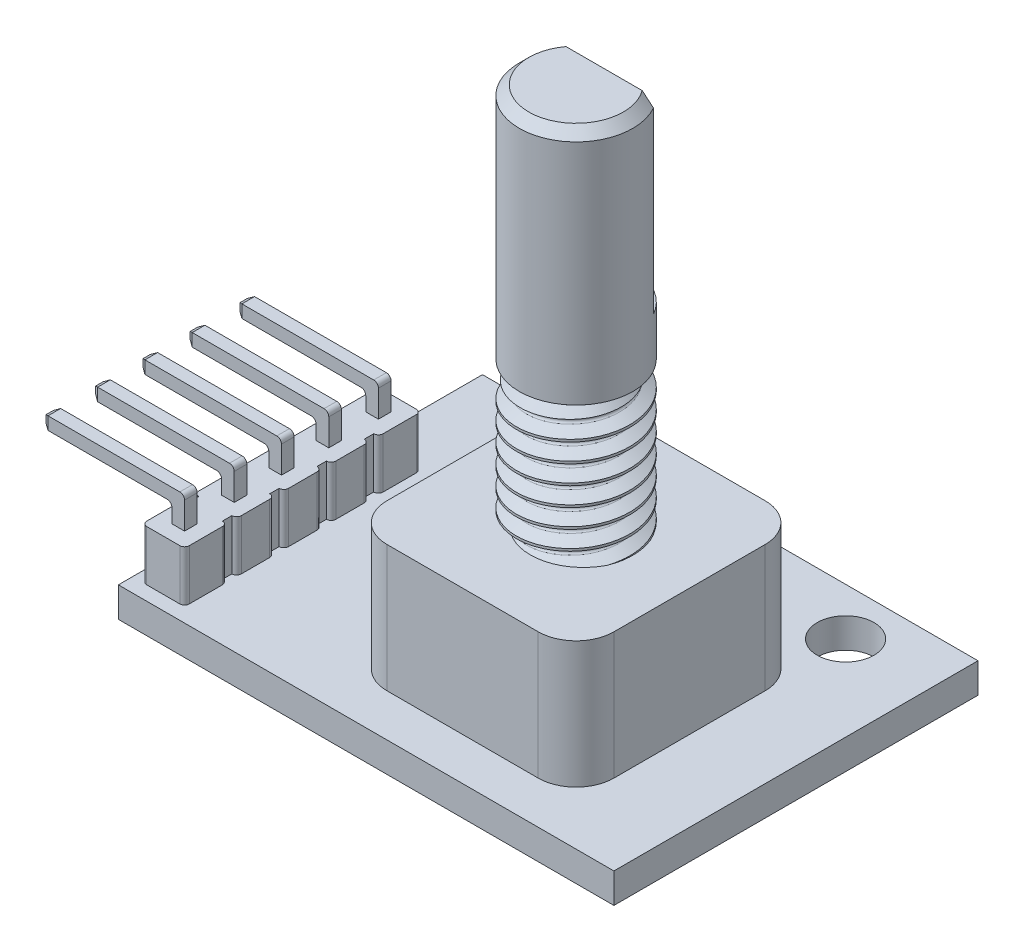
from build123d import *
from OCP.BRepFilletAPI import BRepFilletAPI_MakeChamfer

# Parameters (mm, degrees)
ESBO_O2_W                 = 26.2
ESBO_O2_H                 = 19.25
ESBO_O2_R                 = 1.5
ESBO_O2_W_2               = 12
ESBO_O2_H_2               = 12
RESSALTO_EXTRUS_O1_DEPTH  = 1.58
ESBO_O2_2_W               = 12
ESBO_O2_2_H               = 12
RESSALTO_EXTRUS_O2_DEPTH  = 8.28
RESSALTO_EXTRUS_O3_DEPTH  = 2.67
FILETE1_R                 = 0.25
ESBO_O4_W                 = 0.67
ESBO_O4_H                 = 0.67
RESSALTO_EXTRUS_O4_DEPTH  = 1.67
ESBO_O5_W                 = 0.67
ESBO_O5_H                 = 0.67
RESSALTO_EXTRUS_O5_DEPTH  = 6.8
FILETE2_R                 = 0.25
CHANFRO1_SIZE             = 0.25
CHANFRO1_SIZE2            = 0.144338
ESBO_O6_R                 = 3
ESBO_O6_R_2               = 1.5
RESSALTO_EXTRUS_O6_DEPTH  = 7
RESSALTO_EXTRUS_O7_START  = 7
ESBO_O6_3_R               = 1.5
RESSALTO_EXTRUS_O7_DEPTH  = 0.5
RESSALTO_EXTRUS_O8_START  = 7.5
ESBO_O6_4_R               = 3
ESBO_O6_4_R_2             = 1.5
RESSALTO_EXTRUS_O8_DEPTH  = 2.6
RESSALTO_EXTRUS_O9_DEPTH  = 9.95
CHANFRO2_SIZE             = 0.5
FILETE3_R                 = 2
CHANFRO3_SIZE             = 0.7
VARREDURA_DE_CORTE1_PITCH = 1
VARREDURA_DE_CORTE1_TO    = 7


with BuildPart() as part:
    # Esboço2 → Ressalto-extrusão1 (new body)
    with BuildSketch(Plane(origin=(0, 0, 0), x_dir=(1, 0, 0), z_dir=(0, 1, 0))):
        with Locations((-2.85, 1.375)):
            Rectangle(ESBO_O2_W, ESBO_O2_H)
        with Locations(Location((-11.15, 8.5, 0), (0, 0, 90))):
            Circle(ESBO_O2_R, mode=Mode.SUBTRACT)
        with Locations(Location((5.75, 8.5, 0), (0, 0, 90))):
            Circle(ESBO_O2_R, mode=Mode.SUBTRACT)
        Rectangle(ESBO_O2_W_2, ESBO_O2_H_2, mode=Mode.SUBTRACT)
    extrude(amount=RESSALTO_EXTRUS_O1_DEPTH)

    # Esboço2<2> → Ressalto-extrusão2 (add)
    with BuildSketch(Plane(origin=(0, 0, 0), x_dir=(1, 0, 0), z_dir=(0, 1, 0))):
        Rectangle(ESBO_O2_2_W, ESBO_O2_2_H)
    extrude(amount=RESSALTO_EXTRUS_O2_DEPTH)

    # Esboço3 → Ressalto-extrusão3 (add)
    with BuildSketch(Plane(origin=(0, 1.58, 0), x_dir=(1, 0, 0), z_dir=(0, 1, 0))):
        Polygon((-15.45, 5), (-13.2, 5), (-13.2, 2.75), (-13.45, 2.75), (-13.45, 2.25), (-13.2, 2.25), (-13.2, 0.25), (-13.45, 0.25), (-13.45, -0.25), (-13.2, -0.25), (-13.2, -2.25), (-13.45, -2.25), (-13.45, -2.75), (-13.2, -2.75), (-13.2, -4.75), (-13.45, -4.75), (-13.45, -5.25), (-13.2, -5.25), (-13.2, -7.5), (-15.45, -7.5), (-15.45, -5.25), (-15.2, -5.25), (-15.2, -4.75), (-15.45, -4.75), (-15.45, -2.75), (-15.2, -2.75), (-15.2, -2.25), (-15.45, -2.25), (-15.45, -0.25), (-15.2, -0.25), (-15.2, 0.25), (-15.45, 0.25), (-15.45, 2.25), (-15.2, 2.25), (-15.2, 2.75), (-15.45, 2.75), align=None)
    extrude(amount=RESSALTO_EXTRUS_O3_DEPTH)

    # Filete1
    filete1_edges = [part.edges().sort_by_distance(p)[0] for p in [
        (-13.2, 2.915, -5),
        (-13.2, 2.915, -2.75),
        (-13.2, 2.915, -2.25),
        (-13.2, 2.915, -0.25),
        (-13.2, 2.915, 0.25),
        (-13.2, 2.915, 2.25),
        (-13.2, 2.915, 2.75),
        (-13.2, 2.915, 5.25),
        (-13.2, 2.915, 4.75),
        (-15.45, 2.915, -5),
        (-15.45, 2.915, -2.75),
        (-15.45, 2.915, -2.25),
        (-15.45, 2.915, -0.25),
        (-15.45, 2.915, 0.25),
        (-15.45, 2.915, 2.25),
        (-15.45, 2.915, 2.75),
        (-15.45, 2.915, 4.75),
        (-15.45, 2.915, 5.25),
        (-13.2, 2.915, 7.5),
        (-15.45, 2.915, 7.5),
    ]]
    fillet(filete1_edges, radius=FILETE1_R - 0.0001)  # a hair under: the kernel refuses the full size

    # Esboço4 → Ressalto-extrusão4 (add)
    with BuildSketch(Plane(origin=(0, 4.25, 0), x_dir=(1, 0, 0), z_dir=(0, 1, 0))):
        with Locations((-14.325, 3.875)):
            Rectangle(ESBO_O4_W, ESBO_O4_H)
        with Locations((-14.325, 1.25)):
            Rectangle(ESBO_O4_W, ESBO_O4_H)
        with Locations((-14.325, -1.25)):
            Rectangle(ESBO_O4_W, ESBO_O4_H)
        with Locations((-14.325, -3.75)):
            Rectangle(ESBO_O4_W, ESBO_O4_H)
        with Locations((-14.325, -6.375)):
            Rectangle(ESBO_O4_W, ESBO_O4_H)
    extrude(amount=RESSALTO_EXTRUS_O4_DEPTH)

    # Esboço5 → Ressalto-extrusão5 (add)
    with BuildSketch(Plane.ZY.offset(14.66)):
        with Locations((6.375, 5.585)):
            Rectangle(ESBO_O5_W, ESBO_O5_H)
        with Locations((3.75, 5.585)):
            Rectangle(ESBO_O5_W, ESBO_O5_H)
        with Locations((1.25, 5.585)):
            Rectangle(ESBO_O5_W, ESBO_O5_H)
        with Locations((-1.25, 5.585)):
            Rectangle(ESBO_O5_W, ESBO_O5_H)
        with Locations((-3.875, 5.585)):
            Rectangle(ESBO_O5_W, ESBO_O5_H)
    extrude(amount=RESSALTO_EXTRUS_O5_DEPTH)

    # Filete2
    filete2_edges = [part.edges().sort_by_distance(p)[0] for p in [
        (-13.99, 5.92, -3.875),
        (-13.99, 5.92, -1.25),
        (-13.99, 5.92, 1.25),
        (-13.99, 5.92, 3.75),
        (-13.99, 5.92, 6.375),
        (-14.66, 5.25, -3.875),
        (-14.66, 5.25, 6.375),
        (-14.66, 5.25, -1.25),
        (-14.66, 5.25, 3.75),
        (-14.66, 5.25, 1.25),
    ]]
    fillet(filete2_edges, radius=FILETE2_R)

    # Chanfro1: one chamfer whose edges measure the first distance from different faces: ONE call of the kernel's chamfer builder (chamfer() names one face for all edges)
    chanfro1_edges_1 = [part.edges().sort_by_distance(p)[0] for p in [
        (-21.46, 5.25, -3.875),
    ]]
    chanfro1_side_1 = [part.faces().sort_by_distance(p)[0] for p in [
        (-18.185, 5.25, -3.875),
    ]]
    chanfro1_edges_2 = [part.edges().sort_by_distance(p)[0] for p in [
        (-21.46, 5.585, -3.54),
    ]]
    chanfro1_side_2 = [part.faces().sort_by_distance(p)[0] for p in [
        (-17.325167, 5.484833, -3.54),
    ]]
    chanfro1_edges_3 = [part.edges().sort_by_distance(p)[0] for p in [
        (-21.46, 5.92, -3.875),
    ]]
    chanfro1_side_3 = [part.faces().sort_by_distance(p)[0] for p in [
        (-17.85, 5.92, -3.875),
    ]]
    chanfro1_edges_4 = [part.edges().sort_by_distance(p)[0] for p in [
        (-21.46, 5.585, -4.21),
    ]]
    chanfro1_side_4 = [part.faces().sort_by_distance(p)[0] for p in [
        (-17.325167, 5.484833, -4.21),
    ]]
    chanfro1_edges_5 = [part.edges().sort_by_distance(p)[0] for p in [
        (-21.46, 5.92, 6.375),
    ]]
    chanfro1_side_5 = [part.faces().sort_by_distance(p)[0] for p in [
        (-17.85, 5.92, 6.375),
    ]]
    chanfro1_edges_6 = [part.edges().sort_by_distance(p)[0] for p in [
        (-21.46, 5.585, 6.04),
    ]]
    chanfro1_side_6 = [part.faces().sort_by_distance(p)[0] for p in [
        (-17.325167, 5.484833, 6.04),
    ]]
    chanfro1_edges_7 = [part.edges().sort_by_distance(p)[0] for p in [
        (-21.46, 5.25, 6.375),
    ]]
    chanfro1_side_7 = [part.faces().sort_by_distance(p)[0] for p in [
        (-18.185, 5.25, 6.375),
    ]]
    chanfro1_edges_8 = [part.edges().sort_by_distance(p)[0] for p in [
        (-21.46, 5.585, 6.71),
    ]]
    chanfro1_side_8 = [part.faces().sort_by_distance(p)[0] for p in [
        (-17.325167, 5.484833, 6.71),
    ]]
    chanfro1_edges_9 = [part.edges().sort_by_distance(p)[0] for p in [
        (-21.46, 5.25, -1.25),
    ]]
    chanfro1_side_9 = [part.faces().sort_by_distance(p)[0] for p in [
        (-18.185, 5.25, -1.25),
    ]]
    chanfro1_edges_10 = [part.edges().sort_by_distance(p)[0] for p in [
        (-21.46, 5.585, -0.915),
    ]]
    chanfro1_side_10 = [part.faces().sort_by_distance(p)[0] for p in [
        (-17.325167, 5.484833, -0.915),
    ]]
    chanfro1_edges_11 = [part.edges().sort_by_distance(p)[0] for p in [
        (-21.46, 5.92, -1.25),
    ]]
    chanfro1_side_11 = [part.faces().sort_by_distance(p)[0] for p in [
        (-17.85, 5.92, -1.25),
    ]]
    chanfro1_edges_12 = [part.edges().sort_by_distance(p)[0] for p in [
        (-21.46, 5.585, -1.585),
    ]]
    chanfro1_side_12 = [part.faces().sort_by_distance(p)[0] for p in [
        (-17.325167, 5.484833, -1.585),
    ]]
    chanfro1_edges_13 = [part.edges().sort_by_distance(p)[0] for p in [
        (-21.46, 5.92, 3.75),
    ]]
    chanfro1_side_13 = [part.faces().sort_by_distance(p)[0] for p in [
        (-17.85, 5.92, 3.75),
    ]]
    chanfro1_edges_14 = [part.edges().sort_by_distance(p)[0] for p in [
        (-21.46, 5.585, 3.415),
    ]]
    chanfro1_side_14 = [part.faces().sort_by_distance(p)[0] for p in [
        (-17.325167, 5.484833, 3.415),
    ]]
    chanfro1_edges_15 = [part.edges().sort_by_distance(p)[0] for p in [
        (-21.46, 5.25, 3.75),
    ]]
    chanfro1_side_15 = [part.faces().sort_by_distance(p)[0] for p in [
        (-18.185, 5.25, 3.75),
    ]]
    chanfro1_edges_16 = [part.edges().sort_by_distance(p)[0] for p in [
        (-21.46, 5.585, 4.085),
    ]]
    chanfro1_side_16 = [part.faces().sort_by_distance(p)[0] for p in [
        (-17.325167, 5.484833, 4.085),
    ]]
    chanfro1_edges_17 = [part.edges().sort_by_distance(p)[0] for p in [
        (-21.46, 5.25, 1.25),
    ]]
    chanfro1_side_17 = [part.faces().sort_by_distance(p)[0] for p in [
        (-18.185, 5.25, 1.25),
    ]]
    chanfro1_edges_18 = [part.edges().sort_by_distance(p)[0] for p in [
        (-21.46, 5.585, 1.585),
    ]]
    chanfro1_side_18 = [part.faces().sort_by_distance(p)[0] for p in [
        (-17.325167, 5.484833, 1.585),
    ]]
    chanfro1_edges_19 = [part.edges().sort_by_distance(p)[0] for p in [
        (-21.46, 5.92, 1.25),
    ]]
    chanfro1_side_19 = [part.faces().sort_by_distance(p)[0] for p in [
        (-17.85, 5.92, 1.25),
    ]]
    chanfro1_edges_20 = [part.edges().sort_by_distance(p)[0] for p in [
        (-21.46, 5.585, 0.915),
    ]]
    chanfro1_side_20 = [part.faces().sort_by_distance(p)[0] for p in [
        (-17.325167, 5.484833, 0.915),
    ]]
    chanfro1 = BRepFilletAPI_MakeChamfer(part.part.solid().wrapped)
    for e in chanfro1_edges_1:
        chanfro1.Add(CHANFRO1_SIZE, CHANFRO1_SIZE2, e.wrapped, chanfro1_side_1[0].wrapped)  # the first distance lies on this face
    for e in chanfro1_edges_2:
        chanfro1.Add(CHANFRO1_SIZE, CHANFRO1_SIZE2, e.wrapped, chanfro1_side_2[0].wrapped)  # the first distance lies on this face
    for e in chanfro1_edges_3:
        chanfro1.Add(CHANFRO1_SIZE, CHANFRO1_SIZE2, e.wrapped, chanfro1_side_3[0].wrapped)  # the first distance lies on this face
    for e in chanfro1_edges_4:
        chanfro1.Add(CHANFRO1_SIZE, CHANFRO1_SIZE2, e.wrapped, chanfro1_side_4[0].wrapped)  # the first distance lies on this face
    for e in chanfro1_edges_5:
        chanfro1.Add(CHANFRO1_SIZE, CHANFRO1_SIZE2, e.wrapped, chanfro1_side_5[0].wrapped)  # the first distance lies on this face
    for e in chanfro1_edges_6:
        chanfro1.Add(CHANFRO1_SIZE, CHANFRO1_SIZE2, e.wrapped, chanfro1_side_6[0].wrapped)  # the first distance lies on this face
    for e in chanfro1_edges_7:
        chanfro1.Add(CHANFRO1_SIZE, CHANFRO1_SIZE2, e.wrapped, chanfro1_side_7[0].wrapped)  # the first distance lies on this face
    for e in chanfro1_edges_8:
        chanfro1.Add(CHANFRO1_SIZE, CHANFRO1_SIZE2, e.wrapped, chanfro1_side_8[0].wrapped)  # the first distance lies on this face
    for e in chanfro1_edges_9:
        chanfro1.Add(CHANFRO1_SIZE, CHANFRO1_SIZE2, e.wrapped, chanfro1_side_9[0].wrapped)  # the first distance lies on this face
    for e in chanfro1_edges_10:
        chanfro1.Add(CHANFRO1_SIZE, CHANFRO1_SIZE2, e.wrapped, chanfro1_side_10[0].wrapped)  # the first distance lies on this face
    for e in chanfro1_edges_11:
        chanfro1.Add(CHANFRO1_SIZE, CHANFRO1_SIZE2, e.wrapped, chanfro1_side_11[0].wrapped)  # the first distance lies on this face
    for e in chanfro1_edges_12:
        chanfro1.Add(CHANFRO1_SIZE, CHANFRO1_SIZE2, e.wrapped, chanfro1_side_12[0].wrapped)  # the first distance lies on this face
    for e in chanfro1_edges_13:
        chanfro1.Add(CHANFRO1_SIZE, CHANFRO1_SIZE2, e.wrapped, chanfro1_side_13[0].wrapped)  # the first distance lies on this face
    for e in chanfro1_edges_14:
        chanfro1.Add(CHANFRO1_SIZE, CHANFRO1_SIZE2, e.wrapped, chanfro1_side_14[0].wrapped)  # the first distance lies on this face
    for e in chanfro1_edges_15:
        chanfro1.Add(CHANFRO1_SIZE, CHANFRO1_SIZE2, e.wrapped, chanfro1_side_15[0].wrapped)  # the first distance lies on this face
    for e in chanfro1_edges_16:
        chanfro1.Add(CHANFRO1_SIZE, CHANFRO1_SIZE2, e.wrapped, chanfro1_side_16[0].wrapped)  # the first distance lies on this face
    for e in chanfro1_edges_17:
        chanfro1.Add(CHANFRO1_SIZE, CHANFRO1_SIZE2, e.wrapped, chanfro1_side_17[0].wrapped)  # the first distance lies on this face
    for e in chanfro1_edges_18:
        chanfro1.Add(CHANFRO1_SIZE, CHANFRO1_SIZE2, e.wrapped, chanfro1_side_18[0].wrapped)  # the first distance lies on this face
    for e in chanfro1_edges_19:
        chanfro1.Add(CHANFRO1_SIZE, CHANFRO1_SIZE2, e.wrapped, chanfro1_side_19[0].wrapped)  # the first distance lies on this face
    for e in chanfro1_edges_20:
        chanfro1.Add(CHANFRO1_SIZE, CHANFRO1_SIZE2, e.wrapped, chanfro1_side_20[0].wrapped)  # the first distance lies on this face
    add(Compound.cast(chanfro1.Shape()), mode=Mode.REPLACE)

    # Esboço6 → Ressalto-extrusão6 (add)
    # profile 1 of 2: a face of its own
    with BuildSketch(Plane(origin=(0, 8.28, 0), x_dir=(1, 0, 0), z_dir=(0, 1, 0))):
        with Locations(Location((0, 0, 0), (0, 0, 270))):
            Circle(ESBO_O6_R)
        Circle(ESBO_O6_R_2, mode=Mode.SUBTRACT)
    # profile 2 of 2: a face of its own
    with BuildSketch(Plane(origin=(0, 8.28, 0), x_dir=(1, 0, 0), z_dir=(0, 1, 0))):
        Circle(ESBO_O6_R_2)
    extrude(amount=RESSALTO_EXTRUS_O6_DEPTH)

    # Esboço6<3> → Ressalto-extrusão7 (add)
    with BuildSketch(Plane(origin=(0, 8.28, 0), x_dir=(1, 0, 0), z_dir=(0, 1, 0)).offset(RESSALTO_EXTRUS_O7_START)):
        with Locations(Location((0, 0, 0), (0, 0, 270))):
            Circle(ESBO_O6_3_R)
    extrude(amount=RESSALTO_EXTRUS_O7_DEPTH)

    # Esboço6<4> → Ressalto-extrusão8 (add)
    # profile 1 of 2: a face of its own
    with BuildSketch(Plane(origin=(0, 8.28, 0), x_dir=(1, 0, 0), z_dir=(0, 1, 0)).offset(RESSALTO_EXTRUS_O8_START)):
        with Locations(Location((0, 0, 0), (0, 0, 270))):
            Circle(ESBO_O6_4_R)
        with Locations(Location((0, 0, 0), (0, 0, 270))):
            Circle(ESBO_O6_4_R_2, mode=Mode.SUBTRACT)
    # profile 2 of 2: a face of its own
    with BuildSketch(Plane(origin=(0, 8.28, 0), x_dir=(1, 0, 0), z_dir=(0, 1, 0)).offset(RESSALTO_EXTRUS_O8_START)):
        with Locations(Location((0, 0, 0), (0, 0, 270))):
            Circle(ESBO_O6_4_R_2)
    extrude(amount=RESSALTO_EXTRUS_O8_DEPTH)

    # Esboço7 → Ressalto-extrusão9 (add)
    with BuildSketch(Plane(origin=(0, 18.38, 0), x_dir=(1, 0, 0), z_dir=(0, 1, 0))):
        with BuildLine():
            Line((-2.609521, 1.48), (2.609521, 1.48))
            ThreePointArc((2.609521, 1.48), (0, -3), (-2.609521, 1.48))
        make_face()
    extrude(amount=RESSALTO_EXTRUS_O9_DEPTH)

    # Chanfro2
    chanfro2_edges = [part.edges().sort_by_distance(p)[0] for p in [
        (0, 28.33, 3),
    ]]
    chamfer(chanfro2_edges, length=CHANFRO2_SIZE)

    # Filete3
    filete3_edges = [part.edges().sort_by_distance(p)[0] for p in [
        (6, 4.93, 6),
        (6, 4.93, -6),
        (-6, 4.93, -6),
        (-6, 4.93, 6),
    ]]
    fillet(filete3_edges, radius=FILETE3_R)

    # Chanfro3
    chanfro3_edges = [part.edges().sort_by_distance(p)[0] for p in [
        (0, 15.28, -3),
    ]]
    chamfer(chanfro3_edges, length=CHANFRO3_SIZE)

    # Varredura de corte1: arcs per turn and ends read off the stored shape
    # Varredura de corte1: the profile of Esboço9 profile screwed along a right-hand helix through 7.5 turns, 8 arcs to a turn; built about Z, then put on its axis
    varredura_de_corte1_z = Axis((0, 0, 0), (0, 0, 1))
    varredura_de_corte1_corners = [(3.0003, 0, -0.437655), (3.0003, 0, 0.437655), (2.45877, 0, 0.125002), (2.3866, 0, 0), (2.45877, 0, -0.125002)]
    with BuildLine(mode=Mode.PRIVATE) as varredura_de_corte1_profile:
        Line(varredura_de_corte1_corners[0], varredura_de_corte1_corners[1])
        Line(varredura_de_corte1_corners[1], varredura_de_corte1_corners[2])
        Line(varredura_de_corte1_corners[4], varredura_de_corte1_corners[0])
        ThreePointArc((2.45877, 0, 0.125002), (2.405938, 0, 0.07217), (2.3866, 0, 0))
        ThreePointArc((2.3866, 0, 0), (2.405938, 0, -0.07217), (2.45877, 0, -0.125002))
    varredura_de_corte1_cap = Face(varredura_de_corte1_profile.wire())
    varredura_de_corte1_arcs = [((2.45877, 0, 0.125002), (2.3866, 0, 0.083335), (2.3866, 0, 0), (1, 0.8660254037844383, 1)), ((2.3866, 0, 0), (2.3866, 0, -0.083335), (2.45877, 0, -0.125002), (1, 0.8660254037844383, 1))]  # start, shoulder, end, weights
    varredura_de_corte1_turn_angles = [0, 22.5, 45, 67.5, 90, 112.5, 135, 157.5, 180, 202.5, 225, 247.5, 270, 292.5, 315, 337.5, 360]
    varredura_de_corte1_turn_weights = [1, 0.9238795325112867, 1, 0.9238795325112867, 1, 0.9238795325112867, 1, 0.9238795325112867, 1, 0.9238795325112867, 1, 0.9238795325112867, 1, 0.9238795325112867, 1, 0.9238795325112867, 1]
    varredura_de_corte1_turn_rails = [Edge.make_bspline([Vector(p[0], p[1], 0).rotate(varredura_de_corte1_z, varredura_de_corte1_turn_angles[k]) / varredura_de_corte1_turn_weights[k] + Vector(0, 0, p[2] + VARREDURA_DE_CORTE1_PITCH * varredura_de_corte1_turn_angles[k] / 360) for k in range(17)], [0, 0, 0, 1, 1, 2, 2, 3, 3, 4, 4, 5, 5, 6, 6, 7, 7, 8, 8, 8], 2, varredura_de_corte1_turn_weights) for p in varredura_de_corte1_corners]
    varredura_de_corte1_turn_sides = [*[Face.make_surface_from_curves(varredura_de_corte1_turn_rails[p[0]], varredura_de_corte1_turn_rails[p[1]]) for p in [(0, 1), (1, 2), (4, 0)]], *[Face.make_bezier_surface([[Vector(p[j][0], p[j][1], 0).rotate(varredura_de_corte1_z, varredura_de_corte1_turn_angles[2 * i + k]) / varredura_de_corte1_turn_weights[2 * i + k] + Vector(0, 0, p[j][2] + VARREDURA_DE_CORTE1_PITCH * varredura_de_corte1_turn_angles[2 * i + k] / 360) for k in range(3)] for j in range(3)], [[p[3][j] * varredura_de_corte1_turn_weights[2 * i + k] for k in range(3)] for j in range(3)]) for p in varredura_de_corte1_arcs for i in range(8)]]
    varredura_de_corte1_last_angles = [2520, 2542.5, 2565, 2587.5, 2610, 2632.5, 2655, 2677.5, 2700]
    varredura_de_corte1_last_weights = [1, 0.9238795325112867, 1, 0.9238795325112867, 1, 0.9238795325112867, 1, 0.9238795325112867, 1]
    varredura_de_corte1_last_rails = [Edge.make_bspline([Vector(p[0], p[1], 0).rotate(varredura_de_corte1_z, varredura_de_corte1_last_angles[k]) / varredura_de_corte1_last_weights[k] + Vector(0, 0, p[2] + VARREDURA_DE_CORTE1_PITCH * varredura_de_corte1_last_angles[k] / 360) for k in range(9)], [0, 0, 0, 1, 1, 2, 2, 3, 3, 4, 4, 4], 2, varredura_de_corte1_last_weights) for p in varredura_de_corte1_corners]
    varredura_de_corte1_last_sides = [*[Face.make_surface_from_curves(varredura_de_corte1_last_rails[p[0]], varredura_de_corte1_last_rails[p[1]]) for p in [(0, 1), (1, 2), (4, 0)]], *[Face.make_bezier_surface([[Vector(p[j][0], p[j][1], 0).rotate(varredura_de_corte1_z, varredura_de_corte1_last_angles[2 * i + k]) / varredura_de_corte1_last_weights[2 * i + k] + Vector(0, 0, p[j][2] + VARREDURA_DE_CORTE1_PITCH * varredura_de_corte1_last_angles[2 * i + k] / 360) for k in range(3)] for j in range(3)], [[p[3][j] * varredura_de_corte1_last_weights[2 * i + k] for k in range(3)] for j in range(3)]) for p in varredura_de_corte1_arcs for i in range(4)]]
    varredura_de_corte1 = Plane(origin=(0, 15.28, 0), x_dir=(-1, 0, 0), z_dir=(0, -1, 0)) * split(Solid(Shell([*[p.moved(Location((0, 0, VARREDURA_DE_CORTE1_PITCH * i))) for i in range(7) for p in varredura_de_corte1_turn_sides], *varredura_de_corte1_last_sides, varredura_de_corte1_cap, varredura_de_corte1_cap.rotate(varredura_de_corte1_z, 2700).moved(Location((0, 0, VARREDURA_DE_CORTE1_PITCH * 2700 / 360)))])), bisect_by=Plane.XY.offset(VARREDURA_DE_CORTE1_TO), keep=Keep.BOTTOM, mode=Mode.PRIVATE)
    add(varredura_de_corte1, mode=Mode.SUBTRACT)


solid = part.part
